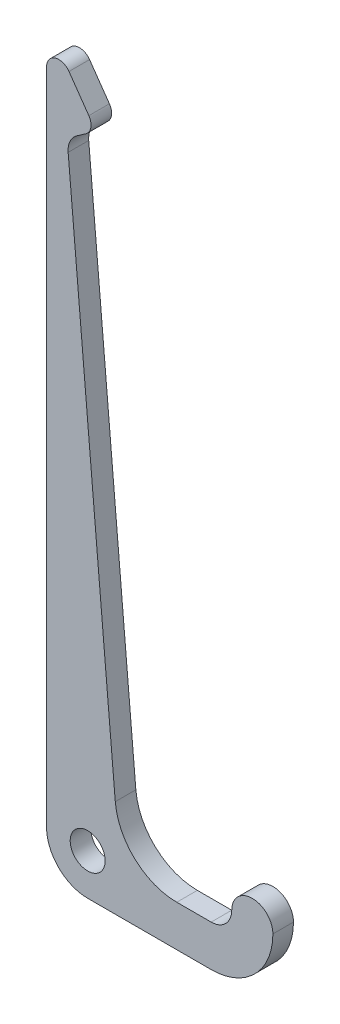
from build123d import *

# Parameters (mm, degrees)
SKETCH_1_R      = 4.25
EXTRUDE_1_DEPTH = 5
FILLET_1_R      = 5
FILLET_2_R      = 15


with BuildPart() as part:
    # Эскиз1 → Бобышка-Вытянуть1 (new body)
    with BuildSketch(Plane.XY):
        with BuildLine():
            Line((-10, -51.794871795), (-10, 108.205128205))
            ThreePointArc((-10, 108.205128205), (-7.902117399, 111.066279057), (-4.542543867, 109.925857514))
            Line((-4.542543867, 109.925857514), (0.279270691, 103.039592664))
            ThreePointArc((0.279270691, 103.039592664), (0.776237817, 100.797918822), (-0.457456133, 98.861407222))
            Line((-0.457456133, 98.861407222), (-2.635311734, 97.336456313))
            ThreePointArc((-2.635311734, 97.336456313), (-4.298968487, 95.353787401), (-4.748403042, 92.804917378))
            Line((-4.748403042, 92.804917378), (6.704486397, -38.102207936))
            ThreePointArc((6.704486397, -38.102207936), (11.513553755, -47.854031847), (21.647406869, -51.794871795))
            Line((21.647406869, -51.794871795), (35, -51.794871795))
            Line((35, -51.794871795), (35, -46.794871795))
            ThreePointArc((35, -46.794871795), (40, -41.794871795), (45, -46.794871795))
            Line((45, -46.794871795), (45, -61.794871795))
            Line((45, -61.794871795), (0, -61.794871795))
            ThreePointArc((0, -61.794871795), (-7.071067812, -58.865939607), (-10, -51.794871795))
        make_face()
        with Locations((0, -51.794871795)):
            Circle(SKETCH_1_R, mode=Mode.SUBTRACT)
    extrude(amount=EXTRUDE_1_DEPTH)

    # Скругление1
    fillet_1_edges = [part.edges().sort_by_distance(p)[0] for p in [
        (35, -51.794871795, 2.5),
    ]]
    fillet(fillet_1_edges, radius=FILLET_1_R - 0.0001)  # a hair under: the kernel refuses the full size

    # Скругление2
    fillet_2_edges = [part.edges().sort_by_distance(p)[0] for p in [
        (45, -61.794871795, 2.5),
    ]]
    fillet(fillet_2_edges, radius=FILLET_2_R - 0.0001)  # a hair under: the kernel refuses the full size


solid = part.part
